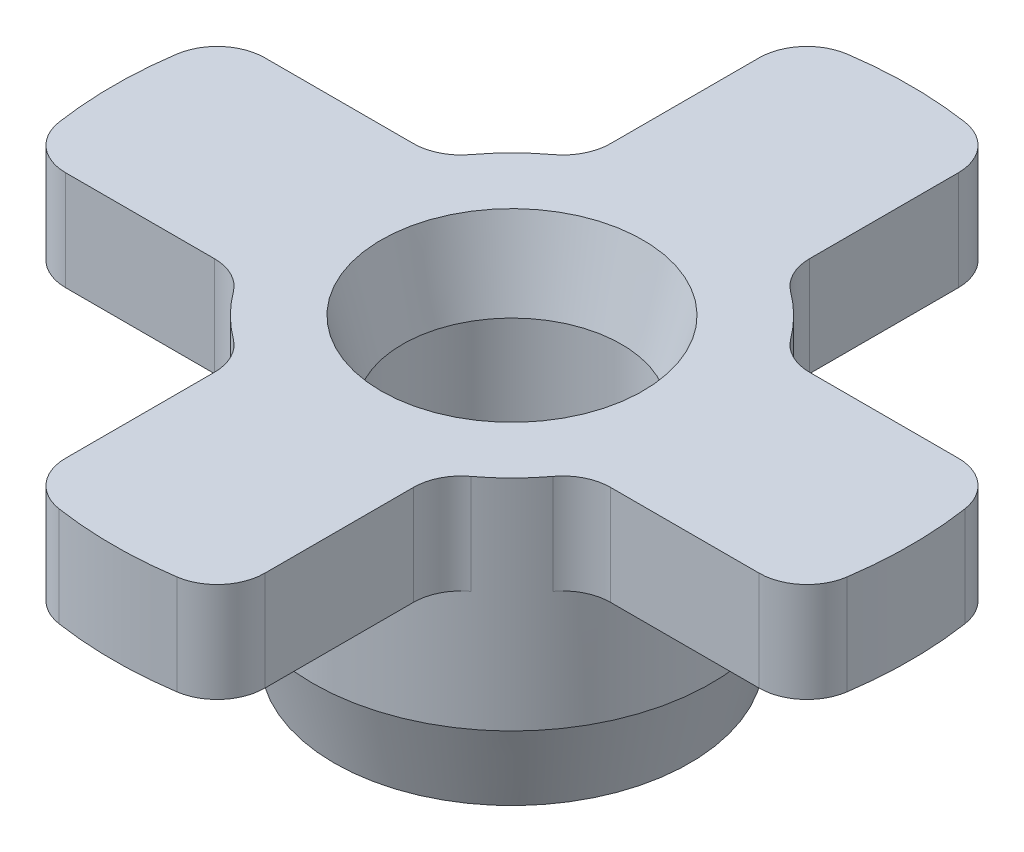
from build123d import *
from OCP.BRepFilletAPI import BRepFilletAPI_MakeChamfer

# Parameters (mm, degrees)
SKETCH1_R           = 3.492500000000002
BOSS_EXTRUDE1_DEPTH = 3.175
BOSS_EXTRUDE2_START = -6.35
SKETCH1_3_R         = 3.4925
BOSS_EXTRUDE2_DEPTH = 6.35
CHAMFER1_SIZE       = 2.54
CHAMFER1_SIZE2      = 0.6805909487750533
FILLET2_R           = 1.524


with BuildPart() as part:
    # Sketch1 → Boss-Extrude1 (new body)
    with BuildSketch(Plane(origin=(0, 0, 0), x_dir=(1, 0, 0), z_dir=(0, 1, 0))):
        with BuildLine():
            ThreePointArc((-3.1750000000000007, 5.499261314031186), (-4.490128060534577, 4.490128060534578), (-5.499261314031186, 3.1750000000000016))
            Line((-5.499261314031183, 3.1750000000000007), (-12.296722124208548, 3.1750000000000034))
            ThreePointArc((-12.296722124208548, 3.175000000000004), (-12.700000000000001, 1.56e-15), (-12.29672212420855, -3.175000000000001))
            Line((-12.296722124208545, -3.1750000000000003), (-5.499261314031183, -3.175000000000001))
            ThreePointArc((-5.499261314031185, -3.175000000000003), (-4.490128060534575, -4.490128060534579), (-3.174999999999998, -5.499261314031186))
            Line((-3.174999999999998, -5.499261314031185), (-3.1749999999999976, -12.296722124208545))
            ThreePointArc((-3.1750000000000047, -12.296722124208548), (-2.33e-15, -12.700000000000001), (3.175, -12.29672212420855))
            Line((3.175000000000002, -12.296722124208543), (3.175000000000001, -5.499261314031185))
            ThreePointArc((3.175, -5.499261314031186), (4.490128060534578, -4.490128060534577), (5.499261314031187, -3.1749999999999994))
            Line((5.499261314031186, -3.1749999999999985), (12.296722124208548, -3.1749999999999954))
            ThreePointArc((12.296722124208552, -3.174999999999996), (12.700000000000003, 4.44e-15), (12.296722124208548, 3.1750000000000043))
            Line((12.296722124208546, 3.1750000000000043), (5.499261314031185, 3.1750000000000007))
            ThreePointArc((5.499261314031187, 3.175), (4.490128060534579, 4.490128060534575), (3.1749999999999994, 5.499261314031187))
            Line((3.1749999999999994, 5.499261314031186), (3.175, 12.296722124208548))
            ThreePointArc((3.1750000000000003, 12.29672212420855), (8.9e-16, 12.700000000000001), (-3.1749999999999985, 12.29672212420855))
            Line((-3.1749999999999994, 12.29672212420855), (-3.175, 5.499261314031185))
        make_face()
        with Locations(Location((-1.22e-15, -1.22e-15, 0), (0, 0, 270))):
            Circle(SKETCH1_R, mode=Mode.SUBTRACT)
    extrude(amount=BOSS_EXTRUDE1_DEPTH)

    # Sketch1<3> → Boss-Extrude2 (add)
    with BuildSketch(Plane(origin=(0, 0, 0), x_dir=(1, 0, 0), z_dir=(0, 1, 0)).offset(BOSS_EXTRUDE2_START)):
        with BuildLine():
            ThreePointArc((3.174999999999999, 5.499261314031186), (-1.02e-15, 6.35), (-3.175000000000001, 5.499261314031184))
            ThreePointArc((-3.175000000000001, 5.499261314031184), (-4.490128060534576, 4.490128060534577), (-5.499261314031184, 3.175000000000002))
            ThreePointArc((-5.499261314031184, 3.175000000000002), (-6.35, 7.8e-16), (-5.499261314031185, -3.1750000000000007))
            ThreePointArc((-5.499261314031185, -3.1750000000000007), (-4.490128060534575, -4.490128060534578), (-3.174999999999997, -5.499261314031187))
            ThreePointArc((-3.174999999999997, -5.499261314031187), (-1.17e-15, -6.35), (3.1750000000000007, -5.499261314031185))
            ThreePointArc((3.1750000000000007, -5.499261314031185), (4.4901280605345795, -4.490128060534573), (5.499261314031187, -3.1749999999999976))
            ThreePointArc((5.499261314031187, -3.1749999999999976), (6.133628996935584, -1.6435009364010063), (6.35, -1.56e-15))
            ThreePointArc((6.35, 0), (6.133628996935584, 1.6435009364010074), (5.499261314031185, 3.1750000000000007))
            ThreePointArc((5.499261314031185, 3.1750000000000007), (4.490128060534575, 4.490128060534578), (3.174999999999999, 5.499261314031186))
        make_face()
        with Locations(Location((0, 0, 0), (0, 0, 270))):
            Circle(SKETCH1_3_R, mode=Mode.SUBTRACT)
    extrude(amount=BOSS_EXTRUDE2_DEPTH)

    # Chamfer1: one chamfer whose edges measure the first distance from different faces: ONE call of the kernel's chamfer builder (chamfer() names one face for all edges)
    chamfer1_edges_1 = [part.edges().sort_by_distance(p)[0] for p in [
        (3.174999999999999, -6.35, -5.499261314031194),
    ]]
    chamfer1_side_1 = [part.faces().sort_by_distance(p)[0] for p in [
        (3.1749999999999865, -3.175, -5.499261314031195),
    ]]
    chamfer1_edges_2 = [part.edges().sort_by_distance(p)[0] for p in [
        (1.07e-15, -6.35, -3.4925),
    ]]
    chamfer1_side_2 = [part.faces().sort_by_distance(p)[0] for p in [
        (1.07e-15, -3.175, -3.4925),
    ]]
    chamfer1_edges_3 = [part.edges().sort_by_distance(p)[0] for p in [
        (-1.5e-16, 3.175, -3.4925000000000006),
    ]]
    chamfer1_side_3 = [part.faces().sort_by_distance(p)[0] for p in [
        (-1.5e-16, 1.5875, -3.4925000000000006),
    ]]
    chamfer1 = BRepFilletAPI_MakeChamfer(part.part.solid().wrapped)
    for e in chamfer1_edges_1:
        chamfer1.Add(CHAMFER1_SIZE, CHAMFER1_SIZE2, e.wrapped, chamfer1_side_1[0].wrapped)  # the first distance lies on this face
    for e in chamfer1_edges_2:
        chamfer1.Add(CHAMFER1_SIZE, CHAMFER1_SIZE2, e.wrapped, chamfer1_side_2[0].wrapped)  # the first distance lies on this face
    for e in chamfer1_edges_3:
        chamfer1.Add(CHAMFER1_SIZE, CHAMFER1_SIZE2, e.wrapped, chamfer1_side_3[0].wrapped)  # the first distance lies on this face
    add(Compound.cast(chamfer1.Shape()), mode=Mode.REPLACE)

    # Fillet2
    # the kernel refuses this fillet: 1.524 mm, written as the material it adds along each edge
    with BuildSketch(Plane(origin=(3.174999999999999, 0, -5.499261314031187), x_dir=(0.8356194334098631, 0, 0.5493088043239243), z_dir=(0, 1, 0))) as fillet2_piece_1:
        with BuildLine():
            CenterArc((0.8236501414377054, 1.5214428185116744), FILLET2_R, 213.3196069721482, 53.36078605570344)
            Line((-0.44983387507892547, 0.684296200722013), (0, 0))
            ThreePointArc((0, 0), (0.36770095599897257, 0.01065492286802295), (0.7354019119979484, -1e-17))
        make_face()
    extrude(amount=3.175)
    with BuildSketch(Plane(origin=(5.499261314031186, 0, -3.1750000000000007), x_dir=(1, 0, -1.08e-15), z_dir=(0, 1, 0))) as fillet2_piece_2:
        with BuildLine():
            CenterArc((0.8189089115958533, 1.524), FILLET2_R, 216.63921394429647, 53.3607860557035)
            ThreePointArc((-0.40396274497712104, 0.6145161290322583), (-0.19307791187855783, 0.31311090745692627), (0, 0))
            Line((0, 0), (0.8189089115958526, 0))
        make_face()
    extrude(amount=3.175)
    with BuildSketch(Plane(origin=(5.499261314031186, 0, 3.174999999999999), x_dir=(-0.5493088043239248, 0, 0.8356194334098627), z_dir=(0, 1, 0))) as fillet2_piece_3:
        with BuildLine():
            CenterArc((0.8236501414377031, 1.521442818511675), FILLET2_R, 213.31960697214825, 53.3607860557035)
            Line((-0.44983387507892714, 0.6842962007220129), (0, 0))
            ThreePointArc((0, 0), (0.3677009559989749, 0.01065492286802371), (0.7354019119979491, 1e-17))
        make_face()
    extrude(amount=3.175)
    with BuildSketch(Plane(origin=(3.1750000000000007, 0, 5.499261314031186), x_dir=(1.08e-15, 0, 1), z_dir=(0, 1, 0))) as fillet2_piece_4:
        with BuildLine():
            CenterArc((0.8189089115958524, 1.524), FILLET2_R, 216.63921394429642, 53.36078605570356)
            ThreePointArc((-0.4039627449771237, 0.61451612903226), (-0.19307791187855872, 0.3131109074569276), (0, 0))
            Line((0, 0), (0.8189089115958508, 0))
        make_face()
    extrude(amount=3.175)
    with BuildSketch(Plane(origin=(-3.1749999999999976, 0, 5.499261314031186), x_dir=(-0.8356194334098629, 0, -0.5493088043239246), z_dir=(0, 1, 0))) as fillet2_piece_5:
        with BuildLine():
            CenterArc((0.8236501414377089, 1.5214428185116742), FILLET2_R, 213.3196069721482, 53.3607860557035)
            Line((-0.44983387507892214, 0.684296200722013), (0, 0))
            ThreePointArc((0, 0), (0.3677009559989767, 0.0106549228680226), (0.7354019119979527, 1e-17))
        make_face()
    extrude(amount=3.175)
    with BuildSketch(Plane(origin=(-5.499261314031184, 0, 3.1750000000000025), x_dir=(-1, 0, -1.08e-15), z_dir=(0, 1, 0))) as fillet2_piece_6:
        with BuildLine():
            CenterArc((0.81890891159585, 1.524), FILLET2_R, 216.6392139442966, 53.36078605570344)
            ThreePointArc((-0.40396274497712237, 0.6145161290322556), (-0.1930779118785585, 0.31311090745692494), (0, 0))
            Line((0, 0), (0.8189089115958517, 0))
        make_face()
    extrude(amount=3.175)
    with BuildSketch(Plane(origin=(-5.499261314031185, 0, -3.1750000000000016), x_dir=(0.5493088043239243, 0, -0.835619433409863), z_dir=(0, 1, 0))) as fillet2_piece_7:
        with BuildLine():
            CenterArc((0.8236501414377072, 1.5214428185116744), FILLET2_R, 213.31960697214814, 53.3607860557035)
            Line((-0.44983387507892447, 0.6842962007220147), (0, 0))
            ThreePointArc((0, 0), (0.3677009559989745, 0.01065492286802321), (0.7354019119979499, -1e-17))
        make_face()
    extrude(amount=3.175)
    with BuildSketch(Plane(origin=(-3.1750000000000007, 0, -5.499261314031186), x_dir=(1.08e-15, 0, -1), z_dir=(0, 1, 0))) as fillet2_piece_8:
        with BuildLine():
            CenterArc((0.8189089115958518, 1.524), FILLET2_R, 216.63921394429659, 53.3607860557035)
            ThreePointArc((-0.4039627449771215, 0.614516129032256), (-0.19307791187855938, 0.3131109074569254), (0, 0))
            Line((0, 0), (0.8189089115958534, 0))
        make_face()
    extrude(amount=3.175)
    # the kernel refuses this fillet: 1.524 mm, written as the material it takes off along each edge
    with BuildSketch(Plane(origin=(3.175, -3.313522044377113, -12.29672212420855), x_dir=(-0.9799720802882134, 0, -0.1991349337901098), z_dir=(0, 1, 0))) as fillet2_2_piece_1:
        with BuildLine():
            CenterArc((1.2458842886857948, 1.5219237330684425), FILLET2_R, 191.48637688209308, 81.5047584217437)
            Line((-0.24759316167344236, 1.218442093972315), (0, 0))
            ThreePointArc((0, 0), (0.662704408875422, -0.01730222442965028), (1.325408817750845, 1e-17))
        make_face()
    extrude(amount=9.802044088754226, mode=Mode.SUBTRACT)
    with BuildSketch(Plane(origin=(12.29672212420855, -3.313522044377107, -3.175000000000003), x_dir=(0.1991349337901089, 0, 0.9799720802882137), z_dir=(0, 1, 0))) as fillet2_2_piece_2:
        with BuildLine():
            CenterArc((1.2458842886857953, -1.521923733068443), FILLET2_R, 87.00886469616333, 81.50475842174347)
            Line((-0.24759316167344145, -1.218442093972312), (0, 0))
            ThreePointArc((0, 0), (0.6627044088754213, 0.01730222442965107), (1.3254088177508423, 1e-17))
        make_face()
    extrude(amount=9.802044088754215, mode=Mode.SUBTRACT)
    with BuildSketch(Plane(origin=(12.29672212420855, -3.3135220443771116, 3.1749999999999954), x_dir=(0.19913493379011118, 0, -0.979972080288213), z_dir=(0, 1, 0))) as fillet2_2_piece_3:
        with BuildLine():
            CenterArc((1.2458842886857922, 1.5219237330684423), FILLET2_R, 191.48637688209323, 81.50475842174365)
            Line((-0.24759316167344428, 1.218442093972311), (0, 0))
            ThreePointArc((0, 0), (0.6627044088754224, -0.0173022244296529), (1.3254088177508445, -3e-17))
        make_face()
    extrude(amount=9.802044088754222, mode=Mode.SUBTRACT)
    with BuildSketch(Plane(origin=(3.175000000000002, -3.3135220443771143, 12.296722124208548), x_dir=(0, 0, -1), z_dir=(0, 1, 0))) as fillet2_2_piece_4:
        with BuildLine():
            CenterArc((1.2433436813975014, 1.524), FILLET2_R, 188.4952415782562, 81.50475842174376)
            ThreePointArc((-0.26393519716764224, 1.2988636363636379), (-0.14892329545176253, 0.6459863408655986), (0, 0))
            Line((0, 0), (1.2433436813975014, 0))
        make_face()
    extrude(amount=9.80204408875423, mode=Mode.SUBTRACT)
    with BuildSketch(Plane(origin=(-3.1749999999999976, -3.3135220443771236, 12.29672212420855), x_dir=(0.9799720802882134, 0, 0.1991349337901098), z_dir=(0, 1, 0))) as fillet2_2_piece_5:
        with BuildLine():
            CenterArc((1.2458842886857944, 1.5219237330684423), FILLET2_R, 191.48637688209308, 81.50475842174376)
            Line((-0.2475931616734428, 1.218442093972315), (0, 0))
            ThreePointArc((0, 0), (0.6627044088754224, -0.01730222442965202), (1.325408817750845, 1e-17))
        make_face()
    extrude(amount=9.802044088754247, mode=Mode.SUBTRACT)
    with BuildSketch(Plane(origin=(-12.29672212420855, -3.313522044377118, 3.1750000000000003), x_dir=(1, 0, 0), z_dir=(0, 1, 0))) as fillet2_2_piece_6:
        with BuildLine():
            CenterArc((1.2433436813975014, 1.524), FILLET2_R, 188.4952415782562, 81.50475842174376)
            ThreePointArc((-0.26393519716764224, 1.298863636363638), (-0.1489232954517643, 0.6459863408655999), (0, 0))
            Line((0, 0), (1.2433436813975014, 0))
        make_face()
    extrude(amount=9.802044088754236, mode=Mode.SUBTRACT)
    with BuildSketch(Plane(origin=(-12.29672212420855, -3.313522044377115, -3.1750000000000034), x_dir=(-0.1991349337901111, 0, 0.9799720802882133), z_dir=(0, 1, 0))) as fillet2_2_piece_7:
        with BuildLine():
            CenterArc((1.2458842886857935, 1.5219237330684425), FILLET2_R, 191.4863768820932, 81.50475842174365)
            Line((-0.24759316167344286, 1.2184420939723115), (0, 0))
            ThreePointArc((0, 0), (0.662704408875423, -0.01730222442965109), (1.3254088177508456, -2e-17))
        make_face()
    extrude(amount=9.802044088754231, mode=Mode.SUBTRACT)
    with BuildSketch(Plane(origin=(-3.1749999999999994, -3.3135220443771085, -12.296722124208546), x_dir=(0, 0, 1), z_dir=(0, 1, 0))) as fillet2_2_piece_8:
        with BuildLine():
            CenterArc((1.2433436813974978, 1.524), FILLET2_R, 188.4952415782563, 81.5047584217437)
            ThreePointArc((-0.2639351971676458, 1.2988636363636357), (-0.1489232954517643, 0.6459863408655977), (0, 0))
            Line((0, 0), (1.2433436813974978, 0))
        make_face()
    extrude(amount=9.802044088754217, mode=Mode.SUBTRACT)


solid = part.part
